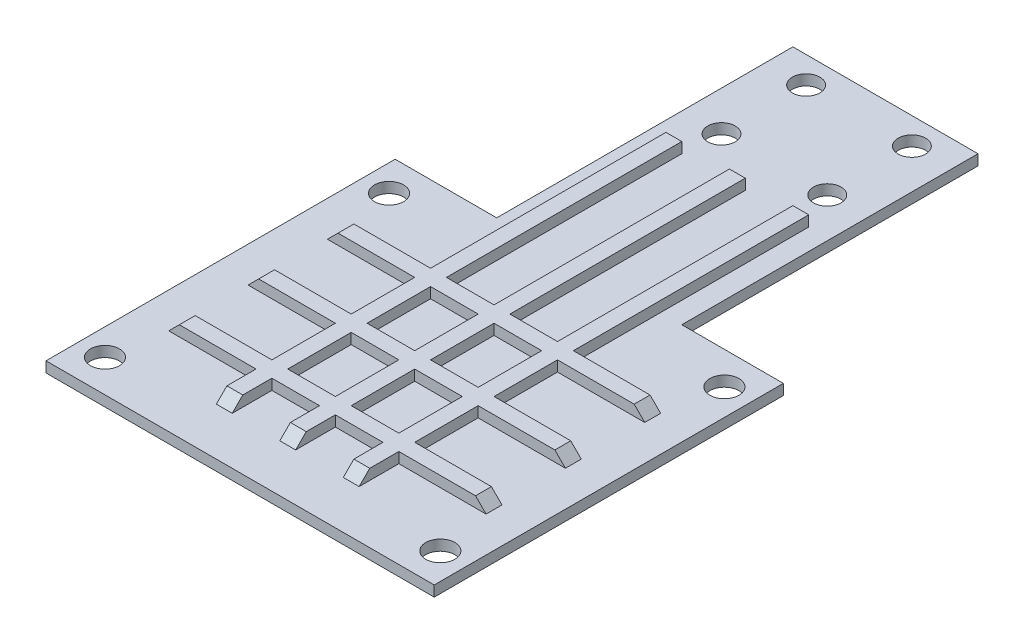
from build123d import *

# Parameters (mm, degrees)
SKETCH1_R                = 2.75
BOSS_EXTRUDE1_DEPTH      = 2
SKETCH2_W                = 3
SKETCH2_H                = 100
BOSS_EXTRUDE2_DEPTH      = 2
SKETCH3_W                = 60
SKETCH3_H                = 3
BOSS_EXTRUDE3_DEPTH      = 2
CHAMFER1_SIZE            = 2
CHAMFER1_OF_MIRROR1_SIZE = 2
CUT_EXTRUDE2_DEPTH       = 122.80201158
CUT_EXTRUDE2_DEPTH_BACK  = 122.80201158
CUT_EXTRUDE3_DEPTH       = 116.034690529
CUT_EXTRUDE3_DEPTH_BACK  = 116.034690529
SKETCH5_R                = 2.6


with BuildPart() as part:
    # Sketch1 → Boss-Extrude1 (new body)
    with BuildSketch(Plane(origin=(0, 0, 0), x_dir=(1, 0, 0), z_dir=(0, 1, 0))):
        Polygon((-17.5, 42.995), (-17.5, -42.995), (-36.7, -42.995), (-36.7, -109.005), (36.7, -109.005), (36.7, -42.995), (17.5, -42.995), (17.5, 42.995), (36.7, 42.995), (36.7, 109.005), (-36.7, 109.005), (-36.7, 42.995), align=None)
        with Locations(Location((-31.7, 102.855, 0), (0, 0, 270))):
            Circle(SKETCH1_R, mode=Mode.SUBTRACT)
        with Locations(Location((-31.7, 49.145, 0), (0, 0, 270))):
            Circle(SKETCH1_R, mode=Mode.SUBTRACT)
        with Locations(Location((31.7, 49.145, 0), (0, 0, 270))):
            Circle(SKETCH1_R, mode=Mode.SUBTRACT)
        with Locations(Location((31.7, 102.855, 0), (0, 0, 270))):
            Circle(SKETCH1_R, mode=Mode.SUBTRACT)
        with Locations(Location((31.7, -102.855, 0), (0, 0, 270))):
            Circle(SKETCH1_R, mode=Mode.SUBTRACT)
        with Locations(Location((31.7, -49.145, 0), (0, 0, 270))):
            Circle(SKETCH1_R, mode=Mode.SUBTRACT)
        with Locations(Location((-31.7, -49.145, 0), (0, 0, 270))):
            Circle(SKETCH1_R, mode=Mode.SUBTRACT)
        with Locations(Location((-31.7, -102.855, 0), (0, 0, 270))):
            Circle(SKETCH1_R, mode=Mode.SUBTRACT)
    extrude(amount=BOSS_EXTRUDE1_DEPTH)

    # Sketch2 → Boss-Extrude2 (add)
    with BuildSketch(Plane(origin=(0, 2, 0), x_dir=(1, 0, 0), z_dir=(0, 1, 0))):
        with Locations((12, -50)):
            Rectangle(SKETCH2_W, SKETCH2_H)
        with Locations((0, -50)):
            Rectangle(SKETCH2_W, SKETCH2_H)
        with Locations((-12, -50)):
            Rectangle(SKETCH2_W, SKETCH2_H)
    boss_extrude2 = extrude(amount=BOSS_EXTRUDE2_DEPTH)

    # Sketch3 → Boss-Extrude3 (add)
    with BuildSketch(Plane(origin=(0, 2, 0), x_dir=(1, 0, 0), z_dir=(0, 1, 0))):
        with Locations((0, -91)):
            Rectangle(SKETCH3_W, SKETCH3_H)
        with Locations((0, -61)):
            Rectangle(SKETCH3_W, SKETCH3_H)
        with Locations((0, -76)):
            Rectangle(SKETCH3_W, SKETCH3_H)
    boss_extrude3 = extrude(amount=BOSS_EXTRUDE3_DEPTH)

    # Chamfer1
    chamfer1_edges = [part.edges().sort_by_distance(p)[0] for p in [
        (30, 4, 61),
        (30, 4, 76),
        (30, 4, 91),
        (12, 4, 100),
        (0, 4, 100),
        (-12, 4, 100),
        (-30, 4, 91),
        (-30, 4, 76),
        (-30, 4, 61),
    ]]
    chamfer(chamfer1_edges, length=CHAMFER1_SIZE - 0.0001)  # a hair under: the kernel refuses the full size

    # Mirror1: Boss-Extrude2, Boss-Extrude3 across plane
    add(boss_extrude2.mirror(Plane.XY))
    add(boss_extrude3.mirror(Plane.XY))

    # Chamfer1 of Mirror1
    chamfer1_of_mirror1_edges = [part.edges().sort_by_distance(p)[0] for p in [
        (30, 4, -61),
        (30, 4, -76),
        (30, 4, -91),
        (12, 4, -100),
        (0, 4, -100),
        (-12, 4, -100),
        (-30, 4, -91),
        (-30, 4, -76),
        (-30, 4, -61),
    ]]
    chamfer(chamfer1_of_mirror1_edges, length=CHAMFER1_OF_MIRROR1_SIZE - 0.0001)  # a hair under: the kernel refuses the full size

    # Sketch4 → Cut-Extrude2 (cut, two sides: drawn at the far end of the back side and taken through both)
    with BuildSketch(Plane(origin=(17.5, 0, 0), x_dir=(0, 0, -1), z_dir=(1, 0, 0)).offset(-CUT_EXTRUDE2_DEPTH_BACK)):
        Polygon((13, 0), (13, 2), (-15, 2), (-15, 4), (109.005, 4), (109.005, 0), align=None)
    extrude(amount=CUT_EXTRUDE2_DEPTH + CUT_EXTRUDE2_DEPTH_BACK, mode=Mode.SUBTRACT)

    # Sketch5 → Cut-Extrude3 (cut, two sides: drawn at the far end of the back side and taken through both)
    with BuildSketch(Plane(origin=(0, 2, 0), x_dir=(1, 0, 0), z_dir=(0, 1, 0)).offset(-CUT_EXTRUDE3_DEPTH_BACK)):
        with Locations(Location((10, -8, 0), (0, 0, 270))):
            Circle(SKETCH5_R)
        with Locations(Location((10, 8, 0), (0, 0, 270))):
            Circle(SKETCH5_R)
        with Locations(Location((-10, 8, 0), (0, 0, 270))):
            Circle(SKETCH5_R)
        with Locations(Location((-10, -8, 0), (0, 0, 270))):
            Circle(SKETCH5_R)
    extrude(amount=CUT_EXTRUDE3_DEPTH + CUT_EXTRUDE3_DEPTH_BACK, mode=Mode.SUBTRACT)


solid = part.part
